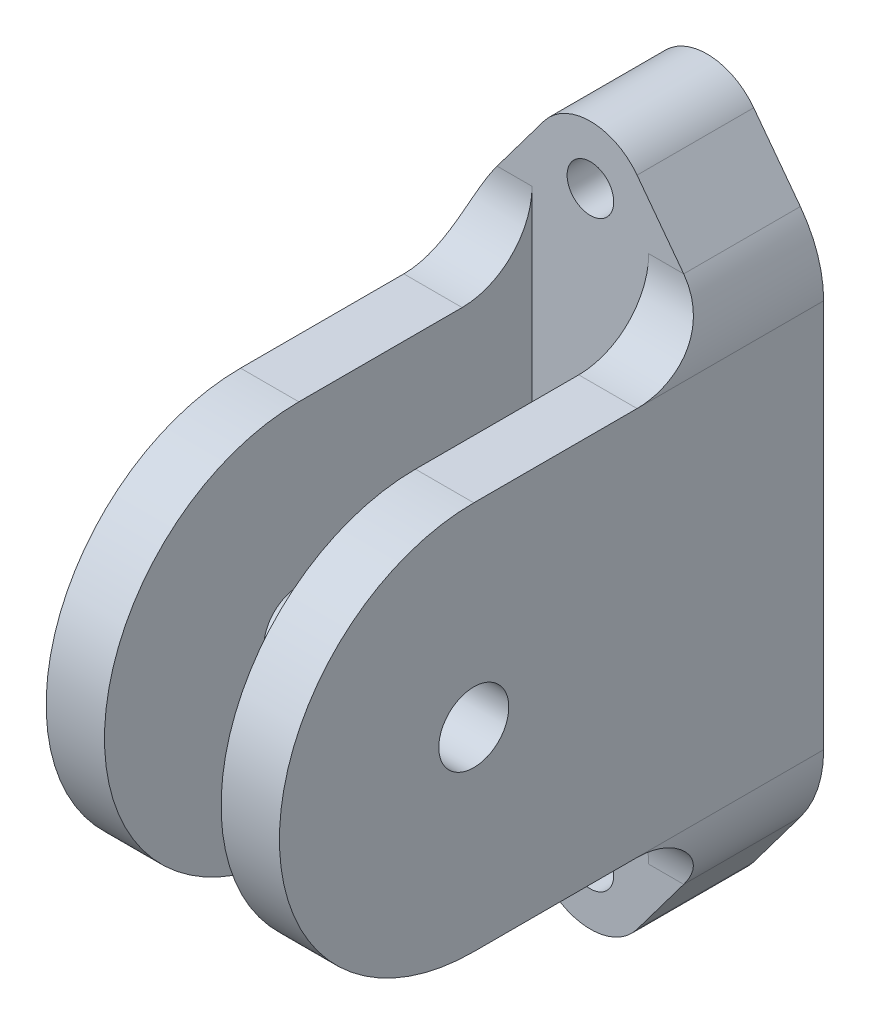
from build123d import *

# Parameters (mm, degrees)
ESQUISSE1_R        = 1
BOSS_EXTRU_1_DEPTH = 5
ESQUISSE2_R        = 1.5
BOSS_EXTRU_2_DEPTH = 2.5
CONG_1_R           = 3


with BuildPart() as part:
    # Esquisse1 → Boss.-Extru.1 (new body)
    with BuildSketch(Plane.XY):
        with BuildLine():
            Line((-4, 11.333333333), (-2, 14))
            ThreePointArc((-2, 14), (0, 15), (2, 14))
            Line((2, 14), (4, 11.333333333))
            ThreePointArc((4, 11.333333333), (4.74341649, 9.914472163), (5, 8.333333333))
            Line((5, 8.333333333), (5, -8.333333333))
            ThreePointArc((5, -8.333333333), (4.74341649, -9.914472163), (4, -11.333333333))
            Line((4, -11.333333333), (2, -14))
            ThreePointArc((2, -14), (0, -15), (-2, -14))
            Line((-2, -14), (-4, -11.333333333))
            ThreePointArc((-4, -11.333333333), (-4.74341649, -9.914472163), (-5, -8.333333333))
            Line((-5, -8.333333333), (-5, 8.333333333))
            ThreePointArc((-5, 8.333333333), (-4.74341649, 9.914472163), (-4, 11.333333333))
        make_face()
        with Locations((0, 12.5)):
            Circle(ESQUISSE1_R, mode=Mode.SUBTRACT)
        with Locations((0, -12.5)):
            Circle(ESQUISSE1_R, mode=Mode.SUBTRACT)
    extrude(amount=BOSS_EXTRU_1_DEPTH)

    # Esquisse2 → Boss.-Extru.2 (add)
    with BuildSketch(Plane.ZY.offset(5)):
        with BuildLine():
            Line((5, 8.333333333), (15, 8.333333333))
            ThreePointArc((15, 8.333333333), (23.333333333, 0), (15, -8.333333333))
            Line((15, -8.333333333), (5, -8.333333333))
            Line((5, -8.333333333), (5, 8.333333333))
        make_face()
        with Locations((15, 0)):
            Circle(ESQUISSE2_R, mode=Mode.SUBTRACT)
    boss_extru_2 = extrude(amount=-BOSS_EXTRU_2_DEPTH)

    # Symétrie1: Boss.-Extru.2 across plane
    add(boss_extru_2.mirror(Plane(origin=(0, 0, 0), x_dir=(0, 0, 1), z_dir=(1, 0, 0))))

    # Congé1
    # the kernel refuses this fillet: 3 mm, written as the material it adds along each edge
    with BuildSketch(Plane(origin=(12.5, 8.333333333, 5), x_dir=(0, 1, 0), z_dir=(-1, 0, 0))) as cong_1_piece_1_section:
        with BuildLine():
            CenterArc((CONG_1_R, -CONG_1_R), CONG_1_R, 90, 90)
            Line((0, -CONG_1_R), (0, 0))
            Line((0, 0), (CONG_1_R, 0))
        make_face()
    cong_1_piece_1 = extrude(amount=10, mode=Mode.PRIVATE)
    cong_1_piece_1 = cong_1_piece_1 & Plane(origin=(0, 8.333333333, 5.683499062), x_dir=(-1, 0, 0), z_dir=(0, 0, -1)) * Cylinder(5, 32, mode=Mode.PRIVATE)
    add(cong_1_piece_1)
    with BuildSketch(Plane(origin=(12.5, 8.333333333, 5), x_dir=(0, 1, 0), z_dir=(-1, 0, 0))) as cong_1_piece_2_section:
        with BuildLine():
            CenterArc((CONG_1_R, -CONG_1_R), CONG_1_R, 90, 90)
            Line((0, -CONG_1_R), (0, 0))
            Line((0, 0), (CONG_1_R, 0))
        make_face()
    cong_1_piece_2 = extrude(amount=17.5, mode=Mode.PRIVATE)
    cong_1_piece_2 = cong_1_piece_2 & Plane(origin=(0, 8.333333333, 5.683498856), x_dir=(-1, 0, 0), z_dir=(0, 0, -1)) * Cylinder(5, 47, mode=Mode.PRIVATE)
    cong_1_piece_2 = split(cong_1_piece_2, bisect_by=Plane(origin=(-2.5, 8.977430515, 5.683498856), z_dir=(-1, 0, 0)), keep=Keep.TOP, mode=Mode.PRIVATE)
    add(cong_1_piece_2)
    with BuildSketch(Plane(origin=(12.5, -8.333333333, 5), x_dir=(0, -1, 0), z_dir=(-1, 0, 0))) as cong_1_piece_3_section:
        with BuildLine():
            CenterArc((CONG_1_R, CONG_1_R), CONG_1_R, 180, 90)
            Line((0, CONG_1_R), (0, 0))
            Line((0, 0), (CONG_1_R, 0))
        make_face()
    cong_1_piece_3 = extrude(amount=10, mode=Mode.PRIVATE)
    cong_1_piece_3 = cong_1_piece_3 & Plane(origin=(0, -8.333333333, 5.683498856), x_dir=(-0.8000000000000032, -0.5999999999999958, 0), z_dir=(0, 0, -1)) * Cylinder(5, 32, mode=Mode.PRIVATE)
    add(cong_1_piece_3)
    with BuildSketch(Plane(origin=(12.5, -8.333333333, 5), x_dir=(0, -1, 0), z_dir=(-1, 0, 0))) as cong_1_piece_4_section:
        with BuildLine():
            CenterArc((CONG_1_R, CONG_1_R), CONG_1_R, 180, 90)
            Line((0, CONG_1_R), (0, 0))
            Line((0, 0), (CONG_1_R, 0))
        make_face()
    cong_1_piece_4 = extrude(amount=17.5, mode=Mode.PRIVATE)
    cong_1_piece_4 = cong_1_piece_4 & Plane(origin=(0, -8.333333333, 5.683499062), x_dir=(-0.8000000000000032, -0.5999999999999958, 0), z_dir=(0, 0, -1)) * Cylinder(5, 47, mode=Mode.PRIVATE)
    cong_1_piece_4 = split(cong_1_piece_4, bisect_by=Plane(origin=(-2.5, -8.97743132, 5.683499062), z_dir=(-1, 0, 0)), keep=Keep.TOP, mode=Mode.PRIVATE)
    add(cong_1_piece_4)
    with BuildSketch(Plane(origin=(-12.5, 8.333333333, 5), x_dir=(0, 1, 0), z_dir=(1, 0, 0))) as cong_1_piece_5_section:
        with BuildLine():
            CenterArc((CONG_1_R, CONG_1_R), CONG_1_R, 180, 90)
            Line((0, CONG_1_R), (0, 0))
            Line((0, 0), (CONG_1_R, 0))
        make_face()
    cong_1_piece_5 = extrude(amount=10, mode=Mode.PRIVATE)
    cong_1_piece_5 = cong_1_piece_5 & Plane(origin=(0, 8.333333333, 5.683498856), x_dir=(-1, 0, 0), z_dir=(0, 0, -1)) * Cylinder(5, 32, mode=Mode.PRIVATE)
    add(cong_1_piece_5)
    with BuildSketch(Plane(origin=(-12.5, 8.333333333, 5), x_dir=(0, 1, 0), z_dir=(1, 0, 0))) as cong_1_piece_6_section:
        with BuildLine():
            CenterArc((CONG_1_R, CONG_1_R), CONG_1_R, 180, 90)
            Line((0, CONG_1_R), (0, 0))
            Line((0, 0), (CONG_1_R, 0))
        make_face()
    cong_1_piece_6 = extrude(amount=17.5, mode=Mode.PRIVATE)
    cong_1_piece_6 = cong_1_piece_6 & Plane(origin=(0, 8.333333333, 5.683499062), x_dir=(-1, 0, 0), z_dir=(0, 0, -1)) * Cylinder(5, 47, mode=Mode.PRIVATE)
    cong_1_piece_6 = split(cong_1_piece_6, bisect_by=Plane(origin=(2.5, 8.97743132, 5.683499062), z_dir=(1, 0, 0)), keep=Keep.TOP, mode=Mode.PRIVATE)
    add(cong_1_piece_6)
    with BuildSketch(Plane(origin=(-12.5, -8.333333333, 5), x_dir=(0, -1, 0), z_dir=(1, 0, 0))) as cong_1_piece_7_section:
        with BuildLine():
            CenterArc((CONG_1_R, -CONG_1_R), CONG_1_R, 90, 90)
            Line((0, -CONG_1_R), (0, 0))
            Line((0, 0), (CONG_1_R, 0))
        make_face()
    cong_1_piece_7 = extrude(amount=10, mode=Mode.PRIVATE)
    cong_1_piece_7 = cong_1_piece_7 & Plane(origin=(0, -8.333333333, 5.683499062), x_dir=(-0.8000000000000032, -0.5999999999999958, 0), z_dir=(0, 0, -1)) * Cylinder(5, 32, mode=Mode.PRIVATE)
    add(cong_1_piece_7)
    with BuildSketch(Plane(origin=(-12.5, -8.333333333, 5), x_dir=(0, -1, 0), z_dir=(1, 0, 0))) as cong_1_piece_8_section:
        with BuildLine():
            CenterArc((CONG_1_R, -CONG_1_R), CONG_1_R, 90, 90)
            Line((0, -CONG_1_R), (0, 0))
            Line((0, 0), (CONG_1_R, 0))
        make_face()
    cong_1_piece_8 = extrude(amount=17.5, mode=Mode.PRIVATE)
    cong_1_piece_8 = cong_1_piece_8 & Plane(origin=(0, -8.333333333, 5.683498856), x_dir=(-0.8000000000000032, -0.5999999999999958, 0), z_dir=(0, 0, -1)) * Cylinder(5, 47, mode=Mode.PRIVATE)
    cong_1_piece_8 = split(cong_1_piece_8, bisect_by=Plane(origin=(2.5, -8.977430515, 5.683498856), z_dir=(1, 0, 0)), keep=Keep.TOP, mode=Mode.PRIVATE)
    add(cong_1_piece_8)


solid = part.part
